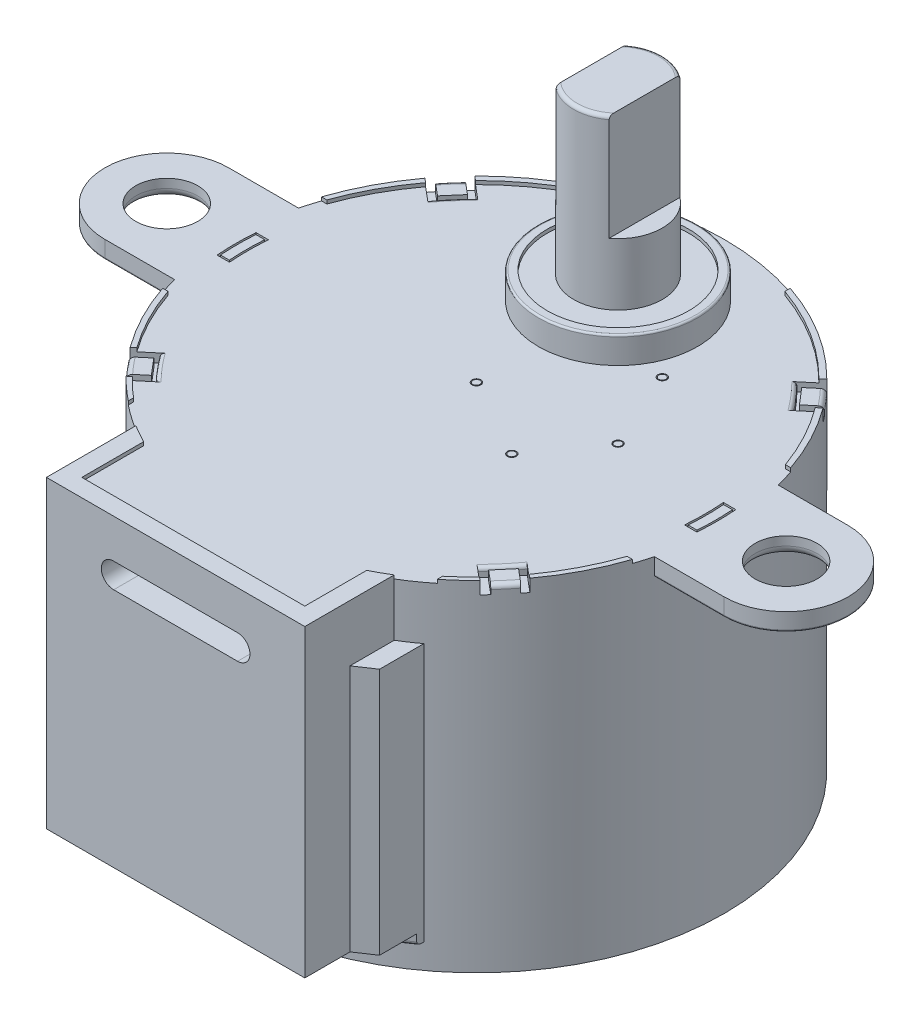
from build123d import *
from OCP.BRepFilletAPI import BRepFilletAPI_MakeFillet

# Parameters (mm, degrees)
BOSS_EXTRUDE1_DEPTH     = 17
SKETCH2_R               = 1.75
BOSS_EXTRUDE2_DEPTH     = 1
BOSS_EXTRUDE3_DEPTH     = 17
SKETCH4_R               = 14
BOSS_EXTRUDE4_DEPTH     = 2
BOSS_EXTRUDE6_DEPTH     = 14
BOSS_EXTRUDE6_2_DEPTH   = 14
CUT_EXTRUDE1_DEPTH      = 5
SKETCH8_R               = 4.5
BOSS_EXTRUDE7_DEPTH     = 1.5
SKETCH9_R               = 4
CUT_EXTRUDE2_DEPTH      = 0.2
SKETCH10_R              = 2.5
BOSS_EXTRUDE8_DEPTH     = 3.5
BOSS_EXTRUDE9_DEPTH     = 6
FILLET1_R               = 0.2
FILLET2_R               = 0.1
CUT_EXTRUDE3_DEPTH      = 1
SKETCH13_R              = 0.25
SKETCH13_R_2            = 0.2
CUT_EXTRUDE4_DEPTH      = 0.2
BOSS_EXTRUDE10_START    = 0.2
BOSS_EXTRUDE10_DEPTH    = 0.2
CUT_EXTRUDE5_DEPTH      = 0.2
CUT_EXTRUDE5_DEPTH_BACK = 0.5
FILLET7_R               = 0.2
BOSS_EXTRUDE11_START    = 0.2
BOSS_EXTRUDE11_DEPTH    = 0.2
CUT_EXTRUDE6_DEPTH      = 0.4
CIRPATTERN1_COUNT       = 8
FILLET8_R               = 0.4
FILLET11_R1             = 0.1
FILLET11_R2             = 0.5
SKETCH23_R              = 0.5
SKETCH23_R_2            = 0.85
CUT_EXTRUDE7_DEPTH      = 0.4
BOSS_EXTRUDE13_DEPTH    = 0.6
FILLET12_R              = 0.2
BOSS_EXTRUDE14_START    = 0.5
BOSS_EXTRUDE14_DEPTH    = 0.5
FILLET13_R              = 0.25


with BuildPart() as part:
    # Sketch1 → Boss-Extrude1 (new body)
    with BuildSketch(Plane(origin=(0, 0, 0), x_dir=(1, 0, 0), z_dir=(0, 1, 0))):
        with BuildLine():
            Line((-6.3, -16), (6.3, -16))
            Line((6.3, -16), (6.3, -12.50239977))
            ThreePointArc((6.3, -12.50239977), (0, 14), (-6.3, -12.50239977))
            Line((-6.3, -12.50239977), (-6.3, -16))
        make_face()
    extrude(amount=-BOSS_EXTRUDE1_DEPTH)

    # Sketch2 → Boss-Extrude2 (add)
    # profile 1 of 2: a face of its own
    with BuildSketch(Plane(origin=(0, 0, 0), x_dir=(1, 0, 0), z_dir=(0, 1, 0))):
        with BuildLine():
            Line((13.555441712, 3.5), (17.5, 3.5))
            ThreePointArc((17.5, 3.5), (21, 0), (17.5, -3.5))
            Line((17.5, -3.5), (13.555441712, -3.5))
            ThreePointArc((13.555441712, -3.5), (14, 0), (13.555441712, 3.5))
        make_face()
        with Locations(Location((17.5, 0, 0), (0, 0, 270))):
            Circle(SKETCH2_R, mode=Mode.SUBTRACT)
    # profile 2 of 2: a face of its own
    with BuildSketch(Plane(origin=(0, 0, 0), x_dir=(1, 0, 0), z_dir=(0, 1, 0))):
        with BuildLine():
            Line((-13.555441712, 3.5), (-17.5, 3.5))
            ThreePointArc((-17.5, 3.5), (-21, 0), (-17.5, -3.5))
            Line((-17.5, -3.5), (-13.555441712, -3.5))
            ThreePointArc((-13.555441712, -3.5), (-14, 0), (-13.555441712, 3.5))
        make_face()
        with Locations(Location((-17.5, 0, 0), (0, 0, 90))):
            Circle(SKETCH2_R, mode=Mode.SUBTRACT)
    extrude(amount=-BOSS_EXTRUDE2_DEPTH)


with BuildPart() as body_2:
    # Sketch3 → Boss-Extrude3 (new body)
    with BuildSketch(Plane(origin=(0, 0, 0), x_dir=(1, 0, 0), z_dir=(0, 1, 0))):
        with BuildLine():
            Line((-6.3, -12.50239977), (-6.3, -16))
            Line((-6.3, -16), (6.3, -16))
            Line((6.3, -16), (6.3, -12.50239977))
            ThreePointArc((6.3, -12.50239977), (6.805685805, -12.234485716), (7.300000001, -11.946129081))
            Line((7.300000001, -11.946129081), (7.300000001, -17))
            Line((7.300000001, -17), (-7.299999999, -17))
            Line((-7.299999999, -17), (-7.299999999, -11.946129081))
            ThreePointArc((-7.299999999, -11.946129081), (-6.805685804, -12.234485716), (-6.3, -12.50239977))
        make_face()
    extrude(amount=-BOSS_EXTRUDE3_DEPTH)


with BuildPart() as body_3:
    # Sketch4 → Boss-Extrude4 (new body)
    with BuildSketch(Plane.XZ.offset(17)):
        with Locations(Location((0, 0, 0), (0, 0, 270))):
            Circle(SKETCH4_R)
    extrude(amount=BOSS_EXTRUDE4_DEPTH)

    # Sketch21 → Cut-Extrude6 (cut)
    with BuildSketch(Plane.XZ.offset(19)):
        with BuildLine():
            Line((-1.25, 6.887488657), (-0.6, 10.387488657))
            Line((-0.6, 10.387488657), (0.6, 10.387488657))
            Line((0.6, 10.387488657), (1.25, 6.887488657))
            ThreePointArc((1.25, 6.887488657), (0, 7), (-1.25, 6.887488657))
        make_face()
    cut_extrude6 = extrude(amount=-CUT_EXTRUDE6_DEPTH, mode=Mode.SUBTRACT)

    # CirPattern1: Cut-Extrude6 ×8 about axis
    cirpattern1_axis = Axis((0, 0, 0), (0, 1, 0))
    for i in range(1, CIRPATTERN1_COUNT):
        add(cut_extrude6.rotate(cirpattern1_axis, i * 360 / CIRPATTERN1_COUNT), mode=Mode.SUBTRACT)

    # Fillet8
    # the kernel refuses this fillet: 0.4 mm, written as the material it takes off along each edge
    with BuildSketch(Plane(origin=(0, -19, 0), x_dir=(0.4466375474291831, 0, -0.8947149832356918), z_dir=(-0.8947149832356918, 0, -0.4466375474291831))) as fillet8_piece_1_section:
        with BuildLine():
            CenterArc((7 - FILLET8_R, -FILLET8_R), FILLET8_R, 0, 90)
            Line((7, -FILLET8_R), (7, 0))
            Line((7, 0), (7 - FILLET8_R, 0))
        make_face()
    fillet8_piece_1 = revolve(axis=Axis((0, -19, 0), (0, -1, 0)), revolution_arc=36.943687471, mode=Mode.PRIVATE)
    fillet8_piece_1 = split(fillet8_piece_1, bisect_by=Plane(origin=(4.159527105, -18.910136178, -5.873032168), z_dir=(0.5661072440079581, 0, 0.8243316009238724)), keep=Keep.TOP, mode=Mode.PRIVATE)
    fillet8_piece_1 = split(fillet8_piece_1, bisect_by=Plane(origin=(5.873032411, -18.910136178, -4.159527458), z_dir=(-0.8243316009238723, 0, -0.5661072440079582)), keep=Keep.TOP, mode=Mode.PRIVATE)
    add(fillet8_piece_1, mode=Mode.SUBTRACT)
    with BuildSketch(Plane(origin=(0, -19, 0), x_dir=(-0.3168385933554622, 0, -0.9484794703948696), z_dir=(-0.9484794703948696, 0, 0.3168385933554622))) as fillet8_piece_2_section:
        with BuildLine():
            CenterArc((7 - FILLET8_R, -FILLET8_R), FILLET8_R, 0, 90)
            Line((7, -FILLET8_R), (7, 0))
            Line((7, 0), (7 - FILLET8_R, 0))
        make_face()
    fillet8_piece_2 = revolve(axis=Axis((0, -19, 0), (0, -1, 0)), revolution_arc=36.943687471, mode=Mode.PRIVATE)
    fillet8_piece_2 = split(fillet8_piece_2, bisect_by=Plane(origin=(-1.21163105, -18.910136178, -7.094090694), z_dir=(0.9831887360764877, 0, 0.18259219384277842)), keep=Keep.TOP, mode=Mode.PRIVATE)
    fillet8_piece_2 = split(fillet8_piece_2, bisect_by=Plane(origin=(1.211630972, -18.910136178, -7.094091117), z_dir=(-0.9831887360764877, 0, 0.1825921938427782)), keep=Keep.TOP, mode=Mode.PRIVATE)
    add(fillet8_piece_2, mode=Mode.SUBTRACT)
    with BuildSketch(Plane(origin=(0, -19, 0), x_dir=(-0.8947149832356917, 0, -0.44663754742918316), z_dir=(-0.44663754742918316, 0, 0.8947149832356917))) as fillet8_piece_3_section:
        with BuildLine():
            CenterArc((7 - FILLET8_R, -FILLET8_R), FILLET8_R, 0, 90)
            Line((7, -FILLET8_R), (7, 0))
            Line((7, 0), (7 - FILLET8_R, 0))
        make_face()
    fillet8_piece_3 = revolve(axis=Axis((0, -19, 0), (0, -1, 0)), revolution_arc=36.943687471, mode=Mode.PRIVATE)
    fillet8_piece_3 = split(fillet8_piece_3, bisect_by=Plane(origin=(-5.873032168, -18.910136178, -4.159527105), z_dir=(0.8243316009238725, 0, -0.566107244007958)), keep=Keep.TOP, mode=Mode.PRIVATE)
    fillet8_piece_3 = split(fillet8_piece_3, bisect_by=Plane(origin=(-4.159527458, -18.910136178, -5.873032411), z_dir=(-0.5661072440079583, 0, 0.8243316009238724)), keep=Keep.TOP, mode=Mode.PRIVATE)
    add(fillet8_piece_3, mode=Mode.SUBTRACT)
    with BuildSketch(Plane(origin=(0, -19, 0), x_dir=(-0.9484794703948696, 0, 0.3168385933554621), z_dir=(0.3168385933554621, 0, 0.9484794703948696))) as fillet8_piece_4_section:
        with BuildLine():
            CenterArc((7 - FILLET8_R, -FILLET8_R), FILLET8_R, 0, 90)
            Line((7, -FILLET8_R), (7, 0))
            Line((7, 0), (7 - FILLET8_R, 0))
        make_face()
    fillet8_piece_4 = revolve(axis=Axis((0, -19, 0), (0, -1, 0)), revolution_arc=36.943687471, mode=Mode.PRIVATE)
    fillet8_piece_4 = split(fillet8_piece_4, bisect_by=Plane(origin=(-7.094090694, -18.910136178, 1.21163105), z_dir=(0.18259219384277853, 0, -0.9831887360764877)), keep=Keep.TOP, mode=Mode.PRIVATE)
    fillet8_piece_4 = split(fillet8_piece_4, bisect_by=Plane(origin=(-7.094091117, -18.910136178, -1.211630972), z_dir=(0.18259219384277808, 0, 0.9831887360764877)), keep=Keep.TOP, mode=Mode.PRIVATE)
    add(fillet8_piece_4, mode=Mode.SUBTRACT)
    with BuildSketch(Plane(origin=(0, -19, 0), x_dir=(-0.4466375474291833, 0, 0.8947149832356917), z_dir=(0.8947149832356917, 0, 0.4466375474291833))) as fillet8_piece_5_section:
        with BuildLine():
            CenterArc((7 - FILLET8_R, -FILLET8_R), FILLET8_R, 0, 90)
            Line((7, -FILLET8_R), (7, 0))
            Line((7, 0), (7 - FILLET8_R, 0))
        make_face()
    fillet8_piece_5 = revolve(axis=Axis((0, -19, 0), (0, -1, 0)), revolution_arc=36.943687471, mode=Mode.PRIVATE)
    fillet8_piece_5 = split(fillet8_piece_5, bisect_by=Plane(origin=(-4.159527105, -18.910136178, 5.873032168), z_dir=(-0.566107244007958, 0, -0.8243316009238725)), keep=Keep.TOP, mode=Mode.PRIVATE)
    fillet8_piece_5 = split(fillet8_piece_5, bisect_by=Plane(origin=(-5.873032411, -18.910136178, 4.159527458), z_dir=(0.8243316009238721, 0, 0.5661072440079583)), keep=Keep.TOP, mode=Mode.PRIVATE)
    add(fillet8_piece_5, mode=Mode.SUBTRACT)
    with BuildSketch(Plane(origin=(0, -19, 0), x_dir=(0.3168385933554623, 0, 0.9484794703948695), z_dir=(0.9484794703948695, 0, -0.3168385933554623))) as fillet8_piece_6_section:
        with BuildLine():
            CenterArc((7 - FILLET8_R, -FILLET8_R), FILLET8_R, 0, 90)
            Line((7, -FILLET8_R), (7, 0))
            Line((7, 0), (7 - FILLET8_R, 0))
        make_face()
    fillet8_piece_6 = revolve(axis=Axis((0, -19, 0), (0, -1, 0)), revolution_arc=36.943687471, mode=Mode.PRIVATE)
    fillet8_piece_6 = split(fillet8_piece_6, bisect_by=Plane(origin=(1.21163105, -18.910136178, 7.094090694), z_dir=(-0.9831887360764877, 0, -0.1825921938427783)), keep=Keep.TOP, mode=Mode.PRIVATE)
    fillet8_piece_6 = split(fillet8_piece_6, bisect_by=Plane(origin=(-1.211630972, -18.910136178, 7.094091117), z_dir=(0.9831887360764877, 0, -0.1825921938427783)), keep=Keep.TOP, mode=Mode.PRIVATE)
    add(fillet8_piece_6, mode=Mode.SUBTRACT)
    with BuildSketch(Plane(origin=(0, -19, 0), x_dir=(0.8947149832356918, 0, 0.4466375474291831), z_dir=(0.4466375474291831, 0, -0.8947149832356918))) as fillet8_piece_7_section:
        with BuildLine():
            CenterArc((7 - FILLET8_R, -FILLET8_R), FILLET8_R, 0, 90)
            Line((7, -FILLET8_R), (7, 0))
            Line((7, 0), (7 - FILLET8_R, 0))
        make_face()
    fillet8_piece_7 = revolve(axis=Axis((0, -19, 0), (0, -1, 0)), revolution_arc=36.943687471, mode=Mode.PRIVATE)
    fillet8_piece_7 = split(fillet8_piece_7, bisect_by=Plane(origin=(5.873032168, -18.910136178, 4.159527105), z_dir=(-0.8243316009238724, 0, 0.5661072440079581)), keep=Keep.TOP, mode=Mode.PRIVATE)
    fillet8_piece_7 = split(fillet8_piece_7, bisect_by=Plane(origin=(4.159527458, -18.910136178, 5.873032411), z_dir=(0.5661072440079582, 0, -0.8243316009238723)), keep=Keep.TOP, mode=Mode.PRIVATE)
    add(fillet8_piece_7, mode=Mode.SUBTRACT)
    with BuildSketch(Plane(origin=(0, -19, 0), x_dir=(0.9484794703948695, 0, -0.31683859335546216), z_dir=(-0.31683859335546216, 0, -0.9484794703948695))) as fillet8_piece_8_section:
        with BuildLine():
            CenterArc((7 - FILLET8_R, -FILLET8_R), FILLET8_R, 0, 90)
            Line((7, -FILLET8_R), (7, 0))
            Line((7, 0), (7 - FILLET8_R, 0))
        make_face()
    fillet8_piece_8 = revolve(axis=Axis((0, -19, 0), (0, -1, 0)), revolution_arc=36.943687471, mode=Mode.PRIVATE)
    fillet8_piece_8 = split(fillet8_piece_8, bisect_by=Plane(origin=(7.094090694, -18.910136178, -1.21163105), z_dir=(-0.18259219384277842, 0, 0.9831887360764877)), keep=Keep.TOP, mode=Mode.PRIVATE)
    fillet8_piece_8 = split(fillet8_piece_8, bisect_by=Plane(origin=(7.094091117, -18.910136178, 1.211630972), z_dir=(-0.1825921938427782, 0, -0.9831887360764877)), keep=Keep.TOP, mode=Mode.PRIVATE)
    add(fillet8_piece_8, mode=Mode.SUBTRACT)

    # Sketch23 → Cut-Extrude7 (cut)
    with BuildSketch(Plane.XZ.offset(19)):
        with Locations(Location((0, 0, 0), (0, 0, 270))):
            Circle(SKETCH23_R)
        with Locations(Location((9.205048535, -3.907311285, 0), (0, 0, 270))):
            Circle(SKETCH23_R_2)
        with Locations(Location((-9.205048535, 3.907311285, 0), (0, 0, 270))):
            Circle(SKETCH23_R_2)
    extrude(amount=-CUT_EXTRUDE7_DEPTH, mode=Mode.SUBTRACT)


with BuildPart() as body_4:
    # Sketch6 → Boss-Extrude6 (new body)
    with BuildSketch(Plane.XZ.offset(17)):
        with BuildLine():
            Line((7.300000001, 14.44612908), (8.300000001, 13.774307074))
            Line((8.300000001, 13.774307074), (8.300000001, 11.274307074))
            ThreePointArc((8.300000001, 11.274307074), (7.80722974, 11.620979468), (7.300000001, 11.94612908))
            Line((7.300000001, 11.94612908), (7.300000001, 14.44612908))
        make_face()
    extrude(amount=-BOSS_EXTRUDE6_DEPTH)


with BuildPart() as body_5:
    # Sketch6 → Boss-Extrude6 2 (new body)
    with BuildSketch(Plane.XZ.offset(17)):
        with BuildLine():
            Line((-7.300000001, 14.44612908), (-7.300000001, 11.94612908))
            ThreePointArc((-7.300000001, 11.94612908), (-7.80722974, 11.620979468), (-8.300000001, 11.274307074))
            Line((-8.300000001, 11.274307074), (-8.300000001, 13.774307074))
            Line((-8.300000001, 13.774307074), (-7.300000001, 14.44612908))
        make_face()
    extrude(amount=-BOSS_EXTRUDE6_2_DEPTH)


with BuildPart() as cut_extrude1_tool:
    # Sketch7 → Cut-Extrude1 (new body)
    with BuildSketch(Plane.XY.offset(17)):
        with BuildLine():
            Line((-3.5, -2), (3.5, -2))
            ThreePointArc((3.5, -2), (4.2, -2.7), (3.5, -3.4))
            Line((3.5, -3.4), (-3.5, -3.4))
            ThreePointArc((-3.5, -3.4), (-4.2, -2.7), (-3.5, -2))
        make_face()
    extrude(amount=-CUT_EXTRUDE1_DEPTH)


with BuildPart() as part_1:
    add(part.part)

    # Cut-Extrude1: cut by cut_extrude1_tool
    add(cut_extrude1_tool.part, mode=Mode.SUBTRACT)

    # Sketch8 → Boss-Extrude7 (add)
    with BuildSketch(Plane(origin=(0, 0, 0), x_dir=(1, 0, 0), z_dir=(0, 1, 0))):
        with Locations(Location((0, 8, 0), (0, 0, 270))):
            Circle(SKETCH8_R)
    extrude(amount=BOSS_EXTRUDE7_DEPTH)

    # Sketch9 → Cut-Extrude2 (cut)
    with BuildSketch(Plane(origin=(0, 1.5, 0), x_dir=(1, 0, 0), z_dir=(0, 1, 0))):
        with Locations(Location((0, 8, 0), (0, 0, 270))):
            Circle(SKETCH9_R)
    extrude(amount=-CUT_EXTRUDE2_DEPTH, mode=Mode.SUBTRACT)

    # Sketch10 → Boss-Extrude8 (add)
    with BuildSketch(Plane(origin=(0, 1.3, 0), x_dir=(1, 0, 0), z_dir=(0, 1, 0))):
        with Locations(Location((0, 8, 0), (0, 0, 270))):
            Circle(SKETCH10_R)
    extrude(amount=BOSS_EXTRUDE8_DEPTH)

    # Sketch11 → Boss-Extrude9 (add)
    with BuildSketch(Plane(origin=(0, 4.8, 0), x_dir=(1, 0, 0), z_dir=(0, 1, 0))):
        with BuildLine():
            Line((-1.5, 10), (-1.5, 6))
            ThreePointArc((-1.5, 6), (0, 5.5), (1.5, 6))
            Line((1.5, 6), (1.5, 10))
            ThreePointArc((1.5, 10), (0, 10.5), (-1.5, 10))
        make_face()
    extrude(amount=BOSS_EXTRUDE9_DEPTH)

    # Fillet1
    fillet1_edges = [part_1.edges().sort_by_distance(p)[0] for p in [
        (0, 10.8, -10.5),
        (0, 10.8, -5.5),
    ]]
    fillet(fillet1_edges, radius=FILLET1_R)

    # Fillet2
    fillet2_edges = [part_1.edges().sort_by_distance(p)[0] for p in [
        (0, 1.5, -12.5),
    ]]
    fillet(fillet2_edges, radius=FILLET2_R)

    # Sketch12 → Cut-Extrude3 (cut)
    # profile 1 of 2: a face of its own
    with BuildSketch(Plane(origin=(0, 0, 0), x_dir=(1, 0, 0), z_dir=(0, 1, 0))):
        with BuildLine():
            Line((-12.856406461, -1.1), (-13.557026713, -1.1))
            ThreePointArc((-13.557026713, -1.1), (-13.6, 0), (-13.557026713, 1.1))
            Line((-13.557026713, 1.1), (-12.856406461, 1.1))
            ThreePointArc((-12.856406461, 1.1), (-12.9, 0), (-12.856406461, -1.1))
        make_face()
        with BuildLine():
            Line((-12.964240044, 1), (-13.464240044, 1))
            ThreePointArc((-13.464240044, 1), (-13.5, 0), (-13.464240044, -1))
            Line((-13.464240044, -1), (-12.964240044, -1))
            ThreePointArc((-12.964240044, -1), (-13, 0), (-12.964240044, 1))
        make_face(mode=Mode.SUBTRACT)
    # profile 2 of 2: a face of its own
    with BuildSketch(Plane(origin=(0, 0, 0), x_dir=(1, 0, 0), z_dir=(0, 1, 0))):
        with BuildLine():
            Line((12.856406461, 1.1), (13.557026713, 1.1))
            ThreePointArc((13.557026713, 1.1), (13.6, 0), (13.557026713, -1.1))
            Line((13.557026713, -1.1), (12.856406461, -1.1))
            ThreePointArc((12.856406461, -1.1), (12.9, 0), (12.856406461, 1.1))
        make_face()
        with BuildLine():
            Line((12.964240044, -1), (13.464240044, -1))
            ThreePointArc((13.464240044, -1), (13.5, 0), (13.464240044, 1))
            Line((13.464240044, 1), (12.964240044, 1))
            ThreePointArc((12.964240044, 1), (13, 0), (12.964240044, -1))
        make_face(mode=Mode.SUBTRACT)
    extrude(amount=-CUT_EXTRUDE3_DEPTH, mode=Mode.SUBTRACT)

    # Sketch13 → Cut-Extrude4 (cut)
    # profile 1 of 4: a face of its own
    with BuildSketch(Plane(origin=(0, 0, 0), x_dir=(1, 0, 0), z_dir=(0, 1, 0))):
        with Locations(Location((0, 0, 0), (0, 0, 270))):
            Circle(SKETCH13_R)
        with Locations(Location((0, 0, 0), (0, 0, 270))):
            Circle(SKETCH13_R_2, mode=Mode.SUBTRACT)
    # profile 2 of 4: a face of its own
    with BuildSketch(Plane(origin=(0, 0, 0), x_dir=(1, 0, 0), z_dir=(0, 1, 0))):
        with Locations(Location((5, 5.5, 0), (0, 0, 270))):
            Circle(SKETCH13_R)
        with Locations(Location((5, 5.5, 0), (0, 0, 270))):
            Circle(SKETCH13_R_2, mode=Mode.SUBTRACT)
    # profile 3 of 4: a face of its own
    with BuildSketch(Plane(origin=(0, 0, 0), x_dir=(1, 0, 0), z_dir=(0, 1, 0))):
        with Locations(Location((4.5, -2.5, 0), (0, 0, 270))):
            Circle(SKETCH13_R)
        with Locations(Location((4.5, -2.5, 0), (0, 0, 270))):
            Circle(SKETCH13_R_2, mode=Mode.SUBTRACT)
    # profile 4 of 4: a face of its own
    with BuildSketch(Plane(origin=(0, 0, 0), x_dir=(1, 0, 0), z_dir=(0, 1, 0))):
        with Locations(Location((7, 1, 0), (0, 0, 270))):
            Circle(SKETCH13_R)
        with Locations(Location((7, 1, 0), (0, 0, 270))):
            Circle(SKETCH13_R_2, mode=Mode.SUBTRACT)
    extrude(amount=-CUT_EXTRUDE4_DEPTH, mode=Mode.SUBTRACT)

    # Sketch15 → Boss-Extrude10 (add)
    with BuildSketch(Plane(origin=(0, 0, 0), x_dir=(1, 0, 0), z_dir=(0, 1, 0)).offset(BOSS_EXTRUDE10_START)):
        with BuildLine():
            Line((-4.457842663, 12.971308858), (-4.457842663, 13.271308858))
            ThreePointArc((-4.457842663, 13.271308858), (-9.883750764, 9.915214109), (-13.257073584, 4.5))
            Line((-13.257073584, 4.5), (-12.957073584, 4.5))
            ThreePointArc((-12.957073584, 4.5), (-9.661108206, 9.692447813), (-4.457842663, 12.971308858))
        make_face()
        with BuildLine():
            Line((-12.971020993, -4.458699564), (-13.271020993, -4.458699564))
            ThreePointArc((-13.271020993, -4.458699564), (-11.468646589, -8.029330322), (-8.730175651, -10.944589216))
            Line((-8.730175651, -10.944589216), (-8.730175651, -10.644589216))
            ThreePointArc((-8.730175651, -10.644589216), (-11.272541187, -7.840914735), (-12.971020993, -4.458699564))
        make_face()
        with BuildLine():
            Line((8.730175651, -10.944589216), (8.730175651, -10.644589216))
            ThreePointArc((8.730175651, -10.644589216), (11.272541187, -7.840914735), (12.971020993, -4.458699564))
            Line((12.971020993, -4.458699564), (13.271020993, -4.458699564))
            ThreePointArc((13.271020993, -4.458699564), (11.468646589, -8.029330322), (8.730175651, -10.944589216))
        make_face()
        with BuildLine():
            Line((12.957073584, 4.5), (13.257073584, 4.5))
            ThreePointArc((13.257073584, 4.5), (9.883750764, 9.915214109), (4.457842663, 13.271308858))
            Line((4.457842663, 13.271308858), (4.457842663, 12.971308858))
            ThreePointArc((4.457842663, 12.971308858), (9.661108206, 9.692447813), (12.957073584, 4.5))
        make_face()
    extrude(amount=-BOSS_EXTRUDE10_DEPTH)

    # Sketch17 → Cut-Extrude5 (cut, two sides: drawn at the far end of the back side and taken through both)
    with BuildSketch(Plane(origin=(0, 0, 0), x_dir=(1, 0, 0), z_dir=(0, 1, 0)).offset(-CUT_EXTRUDE5_DEPTH_BACK)):
        with BuildLine():
            Line((-11.248150928, 8.335412449), (-10.328897597, 7.564067317))
            ThreePointArc((-10.328897597, 7.564067317), (-9.704780037, 8.34621567), (-9.026388911, 9.08178637))
            Line((-9.026388911, 9.08178637), (-9.945642242, 9.853131501))
            ThreePointArc((-9.945642242, 9.853131501), (-10.624033369, 9.117560802), (-11.248150928, 8.335412449))
        make_face()
        with BuildLine():
            Line((-10.374845454, -7.501703437), (-11.294098786, -8.273048569))
            ThreePointArc((-11.294098786, -8.273048569), (-10.674318425, -9.058638207), (-10.000007613, -9.797951201))
            Line((-10.000007613, -9.797951201), (-9.080754281, -9.026606069))
            ThreePointArc((-9.080754281, -9.026606069), (-9.755065093, -8.287293075), (-10.374845454, -7.501703437))
        make_face()
        with BuildLine():
            Line((9.080754281, -9.026606069), (10.000007613, -9.797951201))
            ThreePointArc((10.000007613, -9.797951201), (10.674318425, -9.058638207), (11.294098786, -8.273048569))
            Line((11.294098786, -8.273048569), (10.374845454, -7.501703437))
            ThreePointArc((10.374845454, -7.501703437), (9.755065093, -8.287293075), (9.080754281, -9.026606069))
        make_face()
        with BuildLine():
            Line((9.026388911, 9.08178637), (9.945642242, 9.853131501))
            ThreePointArc((9.945642242, 9.853131501), (10.624033369, 9.117560802), (11.248150928, 8.335412449))
            Line((11.248150928, 8.335412449), (10.328897597, 7.564067317))
            ThreePointArc((10.328897597, 7.564067317), (9.704780037, 8.34621567), (9.026388911, 9.08178637))
        make_face()
    extrude(amount=CUT_EXTRUDE5_DEPTH + CUT_EXTRUDE5_DEPTH_BACK, mode=Mode.SUBTRACT)

    # Fillet7
    fillet7_edges = [part_1.edges().sort_by_distance(p)[0] for p in [
        (-9.704780037, 0, -8.34621567),
        (-9.755065093, 0, 8.287293075),
        (9.755065093, 0, 8.287293075),
        (9.704780037, 0, -8.34621567),
    ]]
    fillet(fillet7_edges, radius=FILLET7_R)



with BuildPart() as body_2_1:
    add(body_2.part)

    # Cut-Extrude1: cut by cut_extrude1_tool
    add(cut_extrude1_tool.part, mode=Mode.SUBTRACT)


with BuildPart() as part_2:
    add(part_1.part)

    add(body_2_1.part)  # Boss-Extrude11 merges body 2
    # Sketch19 → Boss-Extrude11 (add)
    with BuildSketch(Plane(origin=(0, 0, 0), x_dir=(1, 0, 0), z_dir=(0, 1, 0)).offset(BOSS_EXTRUDE11_START)):
        with BuildLine():
            Line((-7.299999999, -11.946129081), (-7.299999999, -17))
            Line((-7.299999999, -17), (7.300000001, -17))
            Line((7.300000001, -17), (7.300000001, -11.94612908))
            ThreePointArc((7.300000001, -11.94612908), (6.805685805, -12.234485716), (6.3, -12.50239977))
            Line((6.3, -12.50239977), (6.3, -16))
            Line((6.3, -16), (-6.3, -16))
            Line((-6.3, -16), (-6.3, -12.50239977))
            ThreePointArc((-6.3, -12.50239977), (-6.805685804, -12.234485716), (-7.299999999, -11.946129081))
        make_face()
    extrude(amount=-BOSS_EXTRUDE11_DEPTH)

    # Fillet11: one fillet with a radius per group of edges: ONE call of the kernel's fillet builder (fillet() takes one radius for all edges)
    fillet11_edges_1 = [part_2.edges().sort_by_distance(p)[0] for p in [
        (-15.527720856, -1, -3.5),
        (-21, -1, 0),
        (-15.527720856, -1, 3.5),
        (15.527720856, -1, 3.5),
        (21, -1, 0),
        (15.527720856, -1, -3.5),
    ]]
    fillet11_edges_2 = [part_2.edges().sort_by_distance(p)[0] for p in [
        (17.5, -1, -1.75),
        (-17.5, -1, 1.75),
    ]]
    fillet11 = BRepFilletAPI_MakeFillet(part_2.part.solid().wrapped)
    for e in fillet11_edges_1:
        fillet11.Add(FILLET11_R1, e.wrapped)
    for e in fillet11_edges_2:
        fillet11.Add(FILLET11_R2, e.wrapped)
    add(Compound.cast(fillet11.Shape()), mode=Mode.REPLACE)


    add(body_3.part)  # Boss-Extrude13 merges body 3

    add(body_4.part)  # Boss-Extrude13 merges body 4

    add(body_5.part)  # Boss-Extrude13 merges body 5
    # Sketch25 → Boss-Extrude13 (add)
    with BuildSketch(Plane.XZ.offset(17)):
        with BuildLine():
            Line((8.300000001, 11.274307074), (8.300000001, 11.674307074))
            ThreePointArc((8.300000001, 11.674307074), (4.958079592, 13.492648577), (1.25, 14.344084767))
            Line((1.25, 14.344084767), (1.25, 13.944084767))
            ThreePointArc((1.25, 13.944084767), (4.958079592, 13.092648577), (8.300000001, 11.274307074))
        make_face()
        with BuildLine():
            Line((-1.25, 13.944084767), (-1.25, 14.344084767))
            ThreePointArc((-1.25, 14.344084767), (-4.958079592, 13.492648577), (-8.300000001, 11.674307074))
            Line((-8.300000001, 11.674307074), (-8.300000001, 11.274307074))
            ThreePointArc((-8.300000001, 11.274307074), (-4.958079592, 13.092648577), (-1.25, 13.944084767))
        make_face()
    extrude(amount=BOSS_EXTRUDE13_DEPTH)

    # Fillet12
    fillet12_edges = [part_2.edges().sort_by_distance(p)[0] for p in [
        (-4.958079592, -17.6, 13.492648577),
        (4.958079592, -17.6, 13.492648577),
    ]]
    fillet(fillet12_edges, radius=FILLET12_R)

    # Sketch27 → Boss-Extrude14 (add)
    with BuildSketch(Plane(origin=(0, -0.5, 0), x_dir=(1, 0, 0), z_dir=(0, 1, 0)).offset(BOSS_EXTRUDE14_START)):
        with BuildLine():
            Line((-11.070727348, -8.569655535), (-10.304682905, -7.926867925))
            Line((-10.304682905, -7.926867925), (-9.530147913, -8.843435187))
            Line((-9.530147913, -8.843435187), (-10.296192357, -9.486222797))
            ThreePointArc((-10.296192357, -9.486222797), (-10.693284729, -9.036241569), (-11.070727348, -8.569655535))
        make_face()
        with BuildLine():
            Line((-10.992787097, 8.669407814), (-10.226742654, 8.026620204))
            Line((-10.226742654, 8.026620204), (-9.443951634, 8.936146575))
            Line((-9.443951634, 8.936146575), (-10.209996077, 9.578934184))
            ThreePointArc((-10.209996077, 9.578934184), (-10.611140991, 9.1325619), (-10.992787097, 8.669407814))
        make_face()
        with BuildLine():
            Line((10.226742654, 8.026620204), (9.443951634, 8.936146575))
            Line((9.443951634, 8.936146575), (10.209996077, 9.578934184))
            ThreePointArc((10.209996077, 9.578934184), (10.611140991, 9.1325619), (10.992787097, 8.669407814))
            Line((10.992787097, 8.669407814), (10.226742654, 8.026620204))
        make_face()
        with BuildLine():
            Line((9.530147913, -8.843435187), (10.304682905, -7.926867925))
            Line((10.304682905, -7.926867925), (11.070727348, -8.569655535))
            ThreePointArc((11.070727348, -8.569655535), (10.693284729, -9.036241569), (10.296192357, -9.486222797))
            Line((10.296192357, -9.486222797), (9.530147913, -8.843435187))
        make_face()
    extrude(amount=-BOSS_EXTRUDE14_DEPTH)

    # Fillet13
    fillet13_edges = [part_2.edges().sort_by_distance(p)[0] for p in [
        (-10.693284729, 0, 9.036241569),
        (-10.611140991, 0, -9.1325619),
        (10.611140991, 0, -9.1325619),
        (10.693284729, 0, 9.036241569),
    ]]
    fillet(fillet13_edges, radius=FILLET13_R)


solid = part_2.part
